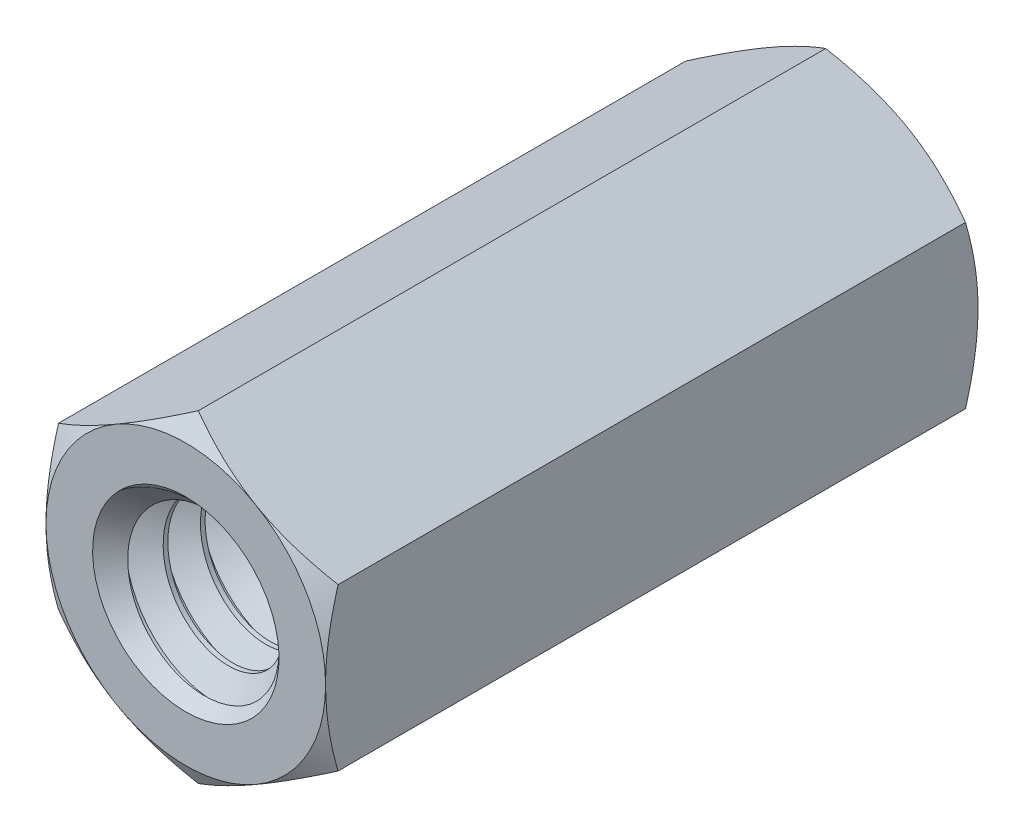
from build123d import *

# Parameters (mm, degrees)
BOSS_EXTRUDE1_DEPTH      = 11.1125
BOSS_EXTRUDE1_DEPTH_BACK = 11.1125
SKETCH1A_R               = 3.175
SKETCH2_OUTSIDE_W        = 101.312
SKETCH2_OUTSIDE_H        = 102.784
SKETCH2_OUTSIDE_R        = 4.7625
CUT_EXTRUDE1_DEPTH       = 24.385335282
CUT_EXTRUDE1_DRAFT       = -60
SKETCH3_OUTSIDE_W        = 101.312
SKETCH3_OUTSIDE_H        = 102.784
SKETCH3_OUTSIDE_R        = 4.7625
CUT_EXTRUDE2_DEPTH       = 24.385335282
CUT_EXTRUDE2_DRAFT       = -60
SWEEP3_PITCH             = 1.27
CUT_EXTRUDE3_DEPTH       = 25.633408263
CUT_EXTRUDE5_DEPTH       = 24.385335397


with BuildPart() as part:
    # Sketch1a → Boss-Extrude1 (new, two sides: drawn at the far end of the back side and taken through both)
    with BuildSketch(Plane.XY.offset(-BOSS_EXTRUDE1_DEPTH_BACK)):
        Polygon((0, 5.499261314), (-4.7625, 2.749630657), (-4.7625, -2.749630657), (0, -5.499261314), (4.7625, -2.749630657), (4.7625, 2.749630657), align=None)
        Circle(SKETCH1A_R, mode=Mode.SUBTRACT)
    extrude(amount=BOSS_EXTRUDE1_DEPTH + BOSS_EXTRUDE1_DEPTH_BACK)


with BuildPart() as cut_extrude1_tool:
    # Sketch2 outside → Cut-Extrude1 (with draft: the straight prism first)
    with BuildSketch(Plane(origin=(0, 0, -11.1125), x_dir=(-1, 0, 0), z_dir=(0, 0, -1))):
        Rectangle(SKETCH2_OUTSIDE_W, SKETCH2_OUTSIDE_H)
        Circle(SKETCH2_OUTSIDE_R, mode=Mode.SUBTRACT)
    extrude(amount=-CUT_EXTRUDE1_DEPTH)
    # Cut-Extrude1: the draft: its side faces are tilted about the plane it starts from
    cut_extrude1_sides = [cut_extrude1_tool.faces().sort_by_distance(p)[0] for p in [
        (0, -51.392, 1.080167641),
        (-50.656, 0, 1.080167641),
        (0, 51.392, 1.080167641),
        (50.656, 0, 1.080167641),
        (4.7625, 0, 1.080167641),
    ]]
    draft(cut_extrude1_sides, Plane(origin=(0, 0, -11.1125), x_dir=(-1, 0, 0), z_dir=(0, 0, -1)), CUT_EXTRUDE1_DRAFT)


with BuildPart() as part_1:
    add(part.part)

    # Cut-Extrude1: cut by cut_extrude1_tool
    add(cut_extrude1_tool.part, mode=Mode.SUBTRACT)


with BuildPart() as cut_extrude2_tool:
    # Sketch3 outside → Cut-Extrude2 (with draft: the straight prism first)
    with BuildSketch(Plane.XY.offset(11.1125)):
        Rectangle(SKETCH3_OUTSIDE_W, SKETCH3_OUTSIDE_H)
        Circle(SKETCH3_OUTSIDE_R, mode=Mode.SUBTRACT)
    extrude(amount=-CUT_EXTRUDE2_DEPTH)
    # Cut-Extrude2: the draft: its side faces are tilted about the plane it starts from
    cut_extrude2_sides = [cut_extrude2_tool.faces().sort_by_distance(p)[0] for p in [
        (0, -51.392, -1.080167641),
        (50.656, 0, -1.080167641),
        (0, 51.392, -1.080167641),
        (-50.656, 0, -1.080167641),
        (-4.7625, 0, -1.080167641),
    ]]
    draft(cut_extrude2_sides, Plane.XY.offset(11.1125), CUT_EXTRUDE2_DRAFT)


with BuildPart() as part_2:
    add(part_1.part)

    # Cut-Extrude2: cut by cut_extrude2_tool
    add(cut_extrude2_tool.part, mode=Mode.SUBTRACT)

    # Sweep3: the profile of Sketch5 screwed along a right-hand helix of 18.5 turns, 8 arcs to a turn; built about Z, then put on its axis
    sweep3_z = Axis((0, 0, 0), (0, 0, 1))
    sweep3_corners = [(3.243740766, 0, 0.0396875), (3.243740766, 0, -1.1509375), (2.350110803, 0, -0.635), (2.350110803, 0, -0.47625)]
    with BuildLine(mode=Mode.PRIVATE) as sweep3_profile:
        Line(sweep3_corners[0], sweep3_corners[1])
        Line(sweep3_corners[1], sweep3_corners[2])
        Line(sweep3_corners[2], sweep3_corners[3])
        Line(sweep3_corners[3], sweep3_corners[0])
    sweep3_cap = Face(sweep3_profile.wire())
    sweep3_turn_angles = [0, 22.5, 45, 67.5, 90, 112.5, 135, 157.5, 180, 202.5, 225, 247.5, 270, 292.5, 315, 337.5, 360]
    sweep3_turn_weights = [1, 0.9238795325112867, 1, 0.9238795325112867, 1, 0.9238795325112867, 1, 0.9238795325112867, 1, 0.9238795325112867, 1, 0.9238795325112867, 1, 0.9238795325112867, 1, 0.9238795325112867, 1]
    sweep3_turn_rails = [Edge.make_bspline([Vector(p[0], p[1], 0).rotate(sweep3_z, sweep3_turn_angles[k]) / sweep3_turn_weights[k] + Vector(0, 0, p[2] + SWEEP3_PITCH * sweep3_turn_angles[k] / 360) for k in range(17)], [0, 0, 0, 1, 1, 2, 2, 3, 3, 4, 4, 5, 5, 6, 6, 7, 7, 8, 8, 8], 2, sweep3_turn_weights) for p in sweep3_corners]
    sweep3_turn_sides = [Face.make_surface_from_curves(sweep3_turn_rails[p[0]], sweep3_turn_rails[p[1]]) for p in [(0, 1), (1, 2), (2, 3), (3, 0)]]
    sweep3_last_angles = [6480, 6502.5, 6525, 6547.5, 6570, 6592.5, 6615, 6637.5, 6660]
    sweep3_last_weights = [1, 0.9238795325112867, 1, 0.9238795325112867, 1, 0.9238795325112867, 1, 0.9238795325112442, 1]
    sweep3_last_rails = [Edge.make_bspline([Vector(p[0], p[1], 0).rotate(sweep3_z, sweep3_last_angles[k]) / sweep3_last_weights[k] + Vector(0, 0, p[2] + SWEEP3_PITCH * sweep3_last_angles[k] / 360) for k in range(9)], [0, 0, 0, 1, 1, 2, 2, 3, 3, 4, 4, 4], 2, sweep3_last_weights) for p in sweep3_corners]
    sweep3_last_sides = [Face.make_surface_from_curves(sweep3_last_rails[p[0]], sweep3_last_rails[p[1]]) for p in [(0, 1), (1, 2), (2, 3), (3, 0)]]
    sweep3 = Plane(origin=(0, 0, 11.1125), x_dir=(0, 1, 0), z_dir=(0, 0, -1)) * Solid(Shell([*[p.moved(Location((0, 0, SWEEP3_PITCH * i))) for i in range(18) for p in sweep3_turn_sides], *sweep3_last_sides, sweep3_cap, sweep3_cap.rotate(sweep3_z, 6660).moved(Location((0, 0, SWEEP3_PITCH * 6660 / 360)))]))
    add(sweep3)

    # Sketch7 → Cut-Extrude3 (cut, through all)
    with BuildSketch(Plane.XY.offset(11.1125)):
        Polygon((0, 5.499261314), (-4.7625, 2.749630657), (-4.7625, -2.749630657), (0, -5.499261314), (4.7625, -2.749630657), (4.7625, 2.749630657), align=None)
    extrude(amount=CUT_EXTRUDE3_DEPTH, mode=Mode.SUBTRACT)

    # Cut-Extrude4 cone 1 section (through the dimple's axis) → Cut-Extrude4 (revolve, cut)
    with BuildSketch(Plane(origin=(0, 0, 11.1125), x_dir=(0, -1, 0), z_dir=(1, 0, 0))):
        Polygon((0, 0), (3.175, 0), (0, 3.175), align=None)
    revolve(axis=Axis((0, 0, 11.1125), (0, 0, -1)), mode=Mode.SUBTRACT)

    # Sketch9 → Cut-Extrude5 (cut, through all)
    with BuildSketch(Plane(origin=(0, 0, -11.1125), x_dir=(-1, 0, 0), z_dir=(0, 0, -1))):
        Polygon((4.7625, 2.749630657), (0, 5.499261314), (-4.7625, 2.749630657), (-4.7625, -2.749630657), (0, -5.499261314), (4.7625, -2.749630657), align=None)
    extrude(amount=CUT_EXTRUDE5_DEPTH, mode=Mode.SUBTRACT)

    # Cut-Extrude6 cone 1 section (through the dimple's axis) → Cut-Extrude6 (revolve, cut)
    with BuildSketch(Plane(origin=(0, 0, -11.1125), x_dir=(0, 1, 0), z_dir=(1, 0, 0))):
        Polygon((0, 0), (3.175, 0), (0, 3.175), align=None)
    revolve(axis=Axis((0, 0, -11.1125), (0, 0, 1)), mode=Mode.SUBTRACT)


solid = part_2.part
